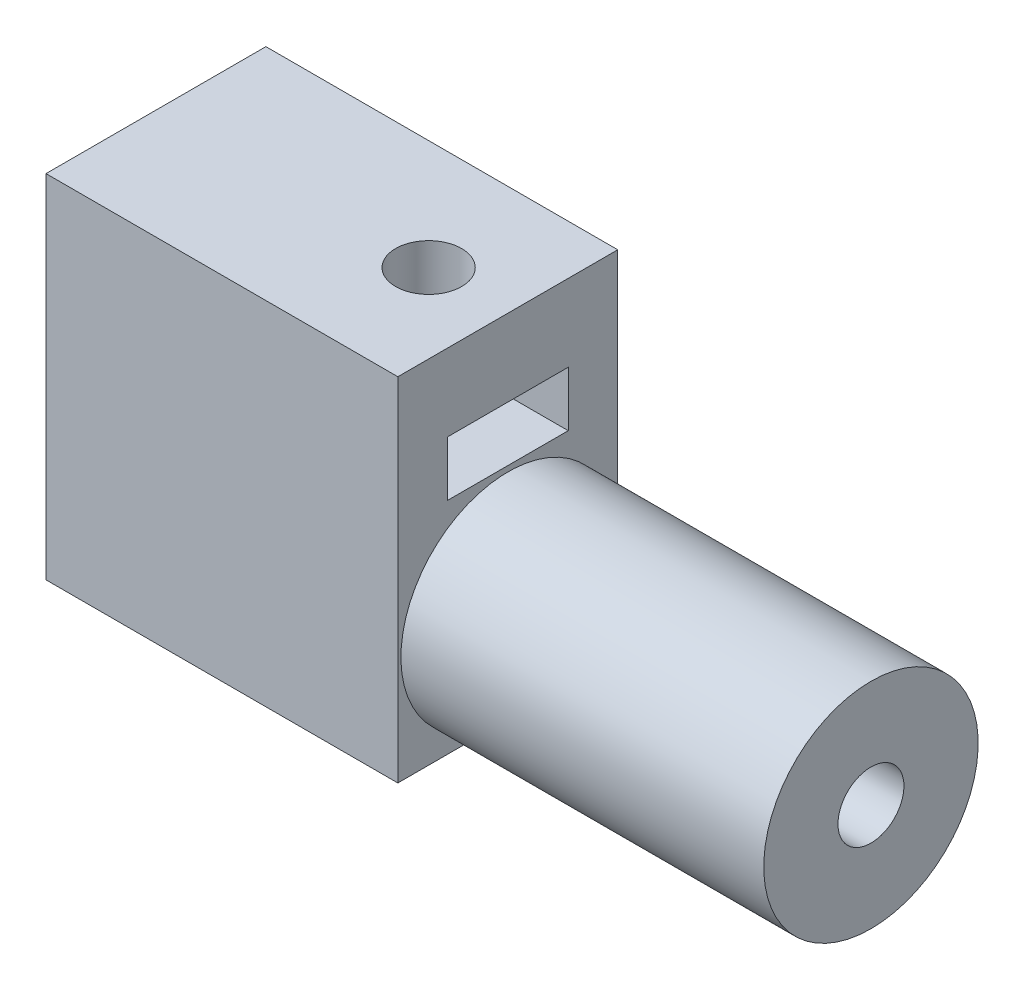
from build123d import *

# Parameters (mm, degrees)
SKETCH1_W           = 16
SKETCH1_H           = 16
BOSS_EXTRUDE1_DEPTH = 10
SKETCH2_R           = 1.5
CUT_EXTRUDE1_DEPTH  = 6
SKETCH3_R           = 1.5
CUT_EXTRUDE2_DEPTH  = 6
CUT_EXTRUDE3_START  = -3.5
CUT_EXTRUDE3_DEPTH  = 2.5
CUT_EXTRUDE5_START  = -3.5
SKETCH6_W           = 5.5
SKETCH6_H           = 8.06
CUT_EXTRUDE5_DEPTH  = 2.5
CUT_EXTRUDE6_START  = -3.5
SKETCH7_R           = 1.5
CUT_EXTRUDE6_DEPTH  = 2.5
SKETCH9_R           = 4.875
BOSS_EXTRUDE2_DEPTH = 16.5
SKETCH10_R          = 1.5
CUT_EXTRUDE7_DEPTH  = 6
CUT_EXTRUDE9_START  = -3.5
CUT_EXTRUDE9_DEPTH  = 2.5


with BuildPart() as part:
    # Sketch1 → Boss-Extrude1 (new body)
    with BuildSketch(Plane.XY):
        Rectangle(SKETCH1_W, SKETCH1_H)
    extrude(amount=BOSS_EXTRUDE1_DEPTH)

    # Sketch2 → Cut-Extrude1 (cut)
    with BuildSketch(Plane.ZY.offset(8)):
        with Locations((5, -3.97)):
            Circle(SKETCH2_R)
    extrude(amount=-CUT_EXTRUDE1_DEPTH, mode=Mode.SUBTRACT)

    # Sketch3 → Cut-Extrude2 (cut)
    with BuildSketch(Plane(origin=(0, 8, 0), x_dir=(1, 0, 0), z_dir=(0, 1, 0))):
        with Locations((4.4, -5)):
            Circle(SKETCH3_R)
    extrude(amount=-CUT_EXTRUDE2_DEPTH, mode=Mode.SUBTRACT)

    # Sketch4 → Cut-Extrude3 (cut)
    with BuildSketch(Plane.ZY.offset(8).offset(CUT_EXTRUDE3_START)):
        Polygon((7.75, -2.38228676), (5, -0.794573519), (2.25, -2.38228676), (2.25, -5.55771324), (5, -7.145426481), (7.75, -5.55771324), align=None)
    extrude(amount=-CUT_EXTRUDE3_DEPTH, mode=Mode.SUBTRACT)

    # Sketch6 → Cut-Extrude5 (cut)
    with BuildSketch(Plane.ZY.offset(8).offset(CUT_EXTRUDE5_START)):
        with Locations((5, -8)):
            Rectangle(SKETCH6_W, SKETCH6_H)
    extrude(amount=-CUT_EXTRUDE5_DEPTH, mode=Mode.SUBTRACT)

    # Sketch7 → Cut-Extrude6 (cut)
    with BuildSketch(Plane(origin=(0, 8, 0), x_dir=(1, 0, 0), z_dir=(0, 1, 0)).offset(CUT_EXTRUDE6_START)):
        Polygon((5.948019915, -7.74933395), (11.539478662, -7.74933395), (11.539478662, -2.25066605), (4.460521338, -2.25066605), (2.873192642, -2.21572404), (1.225342608, -4.930115979), (2.752149966, -7.714391939), (5.926807358, -7.78427596), align=None)
        with Locations((4.4, -5)):
            Circle(SKETCH7_R, mode=Mode.SUBTRACT)
    extrude(amount=-CUT_EXTRUDE6_DEPTH, mode=Mode.SUBTRACT)

    # Sketch9 → Boss-Extrude2 (add)
    with BuildSketch(Plane(origin=(8, 0, 0), x_dir=(0, 0, -1), z_dir=(1, 0, 0))):
        with Locations((-4.985464698, -3.125)):
            Circle(SKETCH9_R)
    extrude(amount=BOSS_EXTRUDE2_DEPTH)

    # Sketch10 → Cut-Extrude7 (cut)
    with BuildSketch(Plane(origin=(24.5, 0, 0), x_dir=(0, 0, -1), z_dir=(1, 0, 0))):
        with Locations((-4.985464698, -3.125)):
            Circle(SKETCH10_R)
    extrude(amount=-CUT_EXTRUDE7_DEPTH, mode=Mode.SUBTRACT)

    # Sketch11 → Cut-Extrude9 (cut)
    with BuildSketch(Plane(origin=(24.5, 0, 0), x_dir=(0, 0, -1), z_dir=(1, 0, 0)).offset(CUT_EXTRUDE9_START)):
        Polygon((-2.235464698, -1.53728676), (-4.985464698, 0.050426481), (-7.735464698, -1.53728676), (-7.735464698, -12.875), (-2.235464698, -12.875), align=None)
    extrude(amount=-CUT_EXTRUDE9_DEPTH, mode=Mode.SUBTRACT)


solid = part.part
